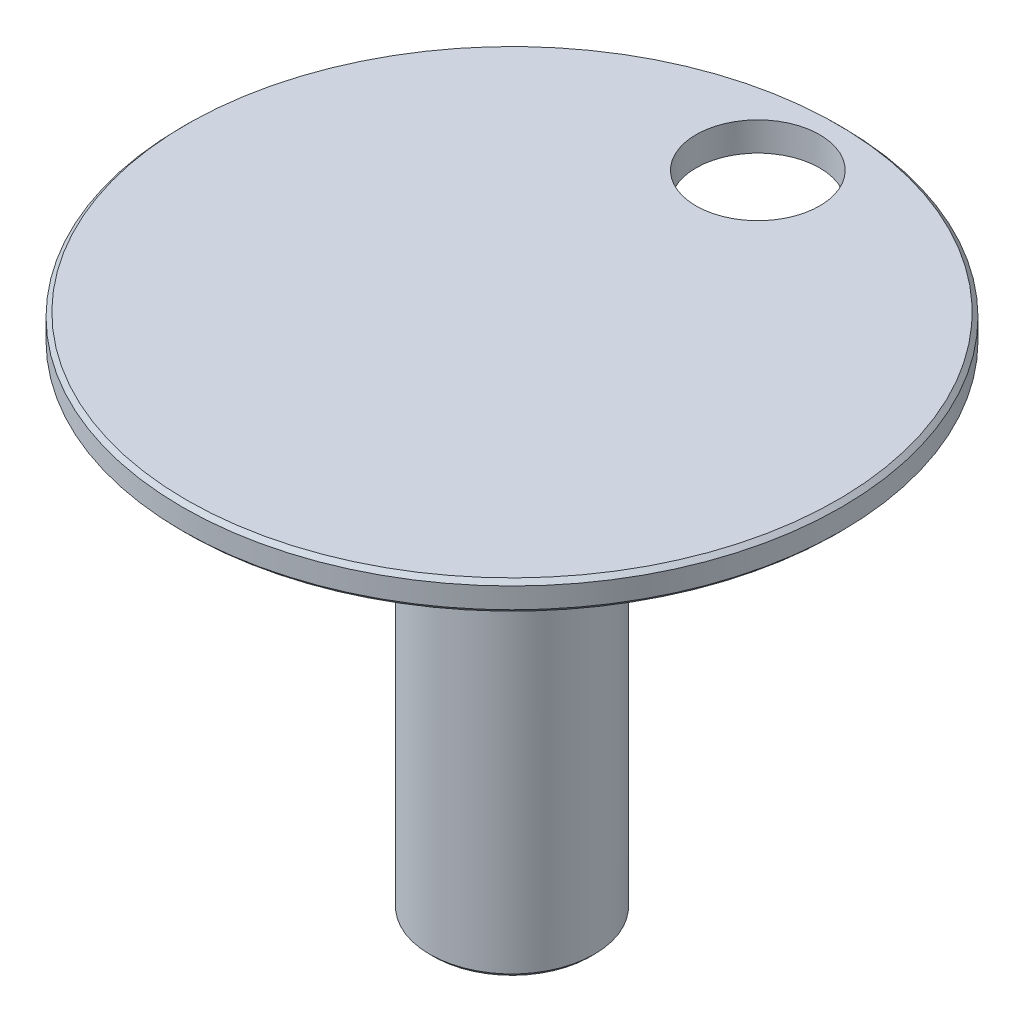
from build123d import *

# Parameters (mm, degrees)
SKETCH2_R          = 1.5
CUT_EXTRUDE1_DEPTH = 10
SKETCH3_R          = 1.5
CUT_EXTRUDE2_DEPTH = 8.5
CHAMFER1_SIZE      = 0.1


with BuildPart() as part:
    # Sketch1 → Revolve1 (revolve)
    with BuildSketch(Plane.XY):
        Polygon((0, 7.486338798), (-8, 7.486338798), (-8, 6.786338798), (-4, 6.786338798), (-4, 6.486338798), (-2, 6.486338798), (-2, -5.113661202), (0, -5.113661202), align=None)
    revolve(axis=Axis((0, 0, 0), (0, -1, 0)))

    # Sketch2 → Cut-Extrude1 (cut)
    with BuildSketch(Plane(origin=(0, 7.486338798, 0), x_dir=(1, 0, 0), z_dir=(0, 1, 0))):
        with Locations((0, 5.968750783)):
            Circle(SKETCH2_R)
    extrude(amount=-CUT_EXTRUDE1_DEPTH, mode=Mode.SUBTRACT)

    # Sketch3 → Cut-Extrude2 (cut)
    with BuildSketch(Plane.XZ.offset(5.113661202)):
        Circle(SKETCH3_R)
    extrude(amount=-CUT_EXTRUDE2_DEPTH, mode=Mode.SUBTRACT)

    # Chamfer1
    chamfer1_edges = [part.edges().sort_by_distance(p)[0] for p in [
        (2, -5.113661202, 0),
        (8, 6.786338798, 0),
        (8, 7.486338798, 0),
    ]]
    chamfer(chamfer1_edges, length=CHAMFER1_SIZE)


solid = part.part
